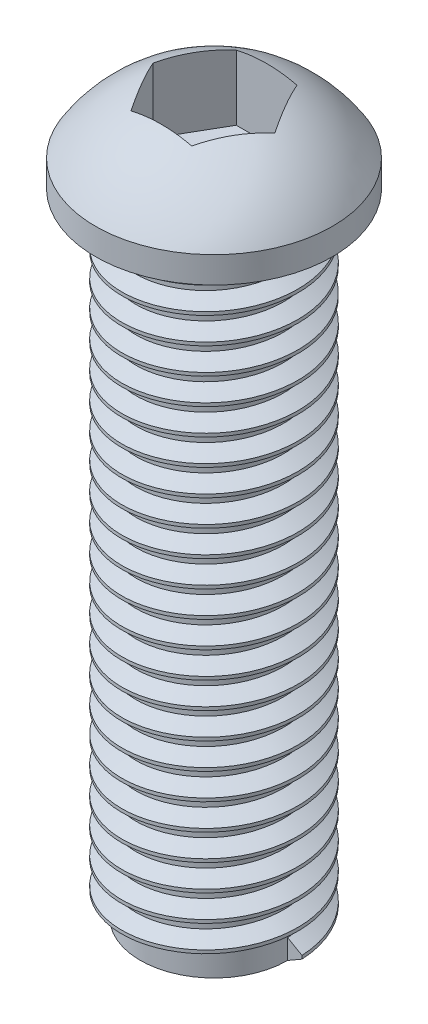
from build123d import *

# Parameters (mm, degrees)
SKETCH1_R           = 1.4
BOSS_EXTRUDE1_DEPTH = 12
CUT_EXTRUDE1_START  = 1.75
CUT_EXTRUDE1_DEPTH  = 1.5
THREAD2_PITCH       = 0.5


with BuildPart() as part:
    # Sketch1 → Boss-Extrude1 (new body)
    with BuildSketch(Plane(origin=(0, 0, 0), x_dir=(1, 0, 0), z_dir=(0, 1, 0))):
        with Locations(Location((0, 0, 0), (0, 0, 270))):
            Circle(SKETCH1_R)
    extrude(amount=-BOSS_EXTRUDE1_DEPTH)

    # Sketch2 → Revolve1 (revolve)
    with BuildSketch(Plane.XY):
        with BuildLine():
            Line((0, 0), (2.25, 0))
            Line((2.25, 0), (2.25, 0.5))
            ThreePointArc((2.25, 0.5), (1.286953768, 1.416516782), (0, 1.75))
            Line((0, 1.75), (0, 0))
        make_face()
    revolve(axis=Axis((0, 0, 0), (0, 1, 0)))

    # Sketch3 → Cut-Extrude1 (cut)
    with BuildSketch(Plane(origin=(0, 0, 0), x_dir=(1, 0, 0), z_dir=(0, 1, 0)).offset(CUT_EXTRUDE1_START)):
        Polygon((1.154700538, 0), (0.577350269, 1), (-0.577350269, 1), (-1.154700538, 0), (-0.577350269, -1), (0.577350269, -1), align=None)
    extrude(amount=-CUT_EXTRUDE1_DEPTH, mode=Mode.SUBTRACT)

    # Thread2: the profile of Thread Profile2 profile screwed along a right-hand helix of 24 turns, 6 arcs to a turn; built about Z, then put on its axis
    thread2_z = Axis((0, 0, 0), (0, 0, 1))
    thread2_corners = [(1.3997, 0, -0.000173205), (1.670632937, 0, 0.156249999), (1.670632937, 0, 0.218749999), (1.3997, 0, 0.375173204)]
    with BuildLine(mode=Mode.PRIVATE) as thread2_profile:
        Line(thread2_corners[0], thread2_corners[1])
        Line(thread2_corners[1], thread2_corners[2])
        Line(thread2_corners[2], thread2_corners[3])
        Line(thread2_corners[3], thread2_corners[0])
    thread2_cap = Face(thread2_profile.wire())
    thread2_turn_angles = [0, 30, 60, 90, 120, 150, 180, 210, 240, 270, 300, 330, 360]
    thread2_turn_weights = [1, 0.8660254037844387, 1, 0.8660254037844387, 1, 0.8660254037844387, 1, 0.8660254037844387, 1, 0.8660254037844387, 1, 0.8660254037844387, 1]
    thread2_turn_rails = [Edge.make_bspline([Vector(p[0], p[1], 0).rotate(thread2_z, thread2_turn_angles[k]) / thread2_turn_weights[k] + Vector(0, 0, p[2] + THREAD2_PITCH * thread2_turn_angles[k] / 360) for k in range(13)], [0, 0, 0, 1, 1, 2, 2, 3, 3, 4, 4, 5, 5, 6, 6, 6], 2, thread2_turn_weights) for p in thread2_corners]
    thread2_turn_sides = [Face.make_surface_from_curves(thread2_turn_rails[p[0]], thread2_turn_rails[p[1]]) for p in [(0, 1), (1, 2), (2, 3), (3, 0)]]
    thread2 = Plane(origin=(0, -12, 0), x_dir=(1, 0, 0), z_dir=(0, 1, 0)) * Solid(Shell([*[p.moved(Location((0, 0, THREAD2_PITCH * i))) for i in range(24) for p in thread2_turn_sides], thread2_cap, thread2_cap.rotate(thread2_z, 8640).moved(Location((0, 0, THREAD2_PITCH * 8640 / 360)))]))
    add(thread2)


solid = part.part
